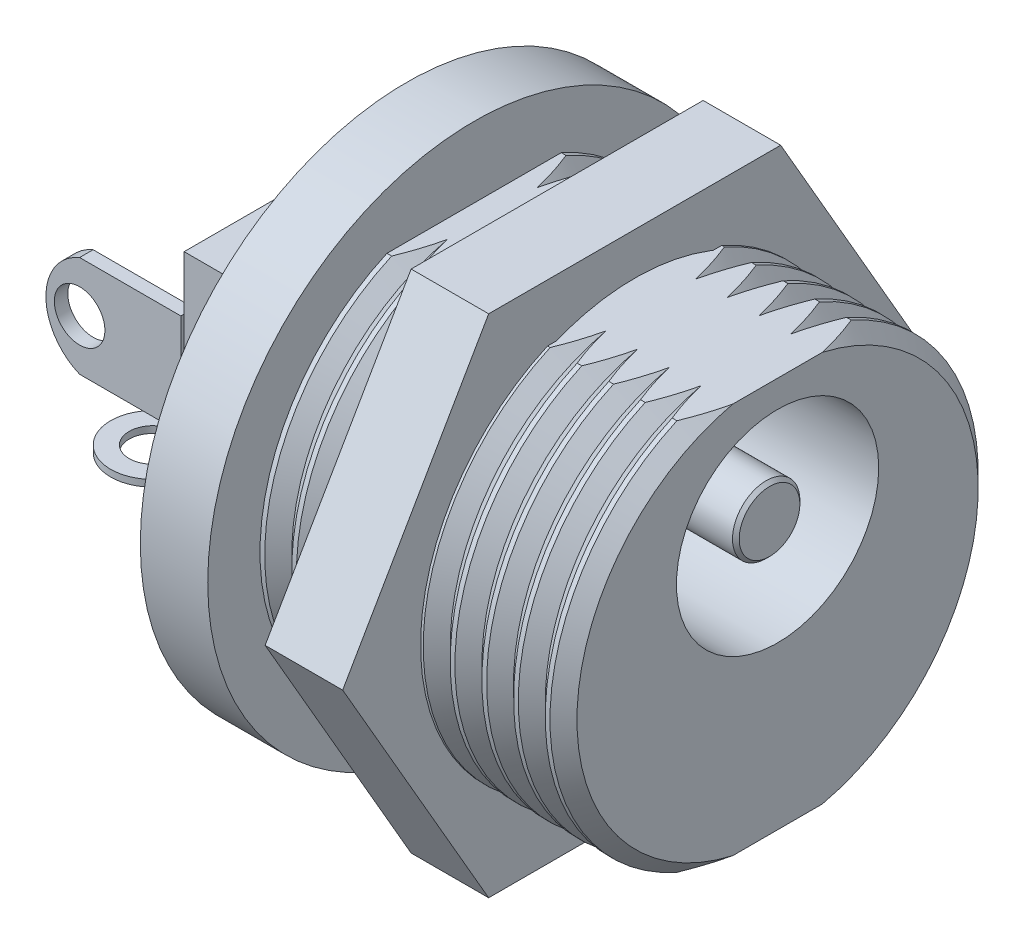
from build123d import *

# Parameters (mm, degrees)
SKETCH82_R           = 6.35
EXTRUDE34_DEPTH      = 9
SKETCH83_R           = 7.9
EXTRUDE35_DEPTH      = 2
SKETCH84_W           = 9.2
SKETCH84_H           = 9.7
EXTRUDE36_DEPTH      = 2
SKETCH85_W           = 2.5
SKETCH85_H           = 0.2
SKETCH85_H_2         = 0.3
SKETCH85_W_2         = 0.4
SKETCH85_H_3         = 3
EXTRUDE37_DEPTH      = 4.9
SKETCH86_R           = 0.75
CUT_EXTRUDE41_DEPTH  = 4.9
FILLET25_R           = 1.25
SKETCH87_R           = 3
CUT_EXTRUDE42_DEPTH  = 9
SKETCH88_R           = 6.25
EXTRUDE38_DEPTH      = 2.3
SKETCH161_R          = 1
EXTRUDE70_DEPTH      = 4
CHAMFER21_SIZE       = 0.1
SKETCH193_R          = 1
EXTRUDE82_DEPTH      = 0.3
SKETCH194_R          = 0.7
CUT_EXTRUDE103_DEPTH = 0.3
SKETCH195_R          = 0.7
CUT_EXTRUDE104_DEPTH = 0.2
LPATTERN3_COUNT      = 10
LPATTERN3_PITCH      = 0.94


with BuildPart() as part:
    # Sketch82 → Extrude34 (new body)
    with BuildSketch(Plane(origin=(0, 0, 0), x_dir=(0, 0, -1), z_dir=(1, 0, 0))):
        Circle(SKETCH82_R)
    extrude(amount=-EXTRUDE34_DEPTH)

    # Sketch83 → Extrude35 (add)
    with BuildSketch(Plane.ZY.offset(9)):
        Circle(SKETCH83_R)
    extrude(amount=EXTRUDE35_DEPTH)

    # Sketch84 → Extrude36 (add)
    with BuildSketch(Plane.ZY.offset(11)):
        Rectangle(SKETCH84_W, SKETCH84_H)
    extrude(amount=EXTRUDE36_DEPTH)

    # Sketch85 → Extrude37 (add)
    with BuildSketch(Plane.ZY.offset(13)):
        with Locations((1.88, -3.4)):
            Rectangle(SKETCH85_W, SKETCH85_H)
        with Locations((-1.52, -1.25)):
            Rectangle(SKETCH85_W, SKETCH85_H_2)
        with Locations((4.5, 1.75)):
            Rectangle(SKETCH85_W_2, SKETCH85_H_3)
    extrude(amount=EXTRUDE37_DEPTH)

    # Sketch86 → Cut-Extrude41 (cut)
    with BuildSketch(Plane(origin=(0, 0, 4.3), x_dir=(-1, 0, 0), z_dir=(0, 0, -1))):
        with Locations((16, 1.75)):
            Circle(SKETCH86_R)
        with BuildLine():
            Line((16, 3.25), (17.9, 3.25))
            Line((17.9, 3.25), (17.9, 0.25))
            Line((17.9, 0.25), (16, 0.25))
            ThreePointArc((16, 0.25), (17, 1.75), (16, 3.25))
        make_face()
    extrude(amount=-CUT_EXTRUDE41_DEPTH, mode=Mode.SUBTRACT)

    # Fillet25
    fillet25_edges = [part.edges().sort_by_distance(p)[0] for p in [
        (-17.9, -3.4, 3.13),
        (-17.9, -3.4, 0.63),
        (-17.9, -1.25, -0.27),
        (-17.9, -1.25, -2.77),
    ]]
    fillet(fillet25_edges, radius=FILLET25_R - 0.0001)  # a hair under: the kernel refuses the full size

    # Sketch87 → Cut-Extrude42 (cut)
    with BuildSketch(Plane(origin=(0, 0, 0), x_dir=(0, 0, -1), z_dir=(1, 0, 0))):
        with Locations((0, 2)):
            Circle(SKETCH87_R)
        with BuildLine():
            Line((-2.585053191, 5.8), (2.585053191, 5.8))
            ThreePointArc((2.585053191, 5.8), (0, 6.35), (-2.585053191, 5.8))
        make_face()
        with BuildLine():
            Line((-2.585053191, -5.8), (2.585053191, -5.8))
            ThreePointArc((2.585053191, -5.8), (0, -6.35), (-2.585053191, -5.8))
        make_face()
    extrude(amount=-CUT_EXTRUDE42_DEPTH, mode=Mode.SUBTRACT)

    # Sketch193 → Extrude82 (add)
    with BuildSketch(Plane.ZY.offset(13)):
        with BuildLine():
            Line((4.3, 3.25), (0, 3.25))
            ThreePointArc((0, 3.25), (-1.5, 1.75), (0, 0.25))
            Line((0, 0.25), (4.3, 0.25))
            Line((4.3, 0.25), (4.3, 3.25))
        make_face()
        with Locations((0, 1.75)):
            Circle(SKETCH193_R, mode=Mode.SUBTRACT)
    extrude(amount=EXTRUDE82_DEPTH)

    # Sketch194 → Cut-Extrude103 (cut)
    with BuildSketch(Plane.XZ.offset(1.4)):
        with Locations(Location((-16.65, -1.52, 0), (0, 0, 270))):
            Circle(SKETCH194_R)
        with BuildLine():
            Line((-13.5, -0.27), (-13.5, -0.67))
            Line((-13.5, -0.67), (-15.733484861, -0.67))
            ThreePointArc((-15.733484861, -0.67), (-16.15, -0.374356076), (-16.65, -0.27))
            Line((-16.65, -0.27), (-13.5, -0.27))
        make_face()
        with BuildLine():
            Line((-13.5, -2.77), (-16.65, -2.77))
            ThreePointArc((-16.65, -2.77), (-16.15, -2.665643924), (-15.733484861, -2.37))
            Line((-15.733484861, -2.37), (-13.5, -2.37))
            Line((-13.5, -2.37), (-13.5, -2.77))
        make_face()
    extrude(amount=-CUT_EXTRUDE103_DEPTH, mode=Mode.SUBTRACT)

    # Sketch195 → Cut-Extrude104 (cut)
    with BuildSketch(Plane.XZ.offset(3.5)):
        with Locations(Location((-16.65, 1.88, 0), (0, 0, 270))):
            Circle(SKETCH195_R)
        with BuildLine():
            Line((-13.5, 0.63), (-16.65, 0.63))
            ThreePointArc((-16.65, 0.63), (-16.15, 0.734356076), (-15.733484861, 1.03))
            Line((-15.733484861, 1.03), (-13.5, 1.03))
            Line((-13.5, 1.03), (-13.5, 0.63))
        make_face()
        with BuildLine():
            Line((-13.5, 3.13), (-16.65, 3.13))
            ThreePointArc((-16.65, 3.13), (-16.15, 3.025643924), (-15.733484861, 2.73))
            Line((-15.733484861, 2.73), (-13.5, 2.73))
            Line((-13.5, 2.73), (-13.5, 3.13))
        make_face()
    extrude(amount=-CUT_EXTRUDE104_DEPTH, mode=Mode.SUBTRACT)

    # Sketch198 → Cut-Revolve14 (revolve, cut)
    with BuildSketch(Plane(origin=(0, 0, 0), x_dir=(1, 0, 0), z_dir=(0, 1, 0))):
        Polygon((-0.4, 6.35), (0, 5.95), (0.4, 6.35), align=None)
    cut_revolve14 = revolve(axis=Axis((0, 0, 0), (-1, 0, 0)), mode=Mode.SUBTRACT)

    # LPattern3: Cut-Revolve14 ×10
    with Locations(*[(-i * LPATTERN3_PITCH, 0, 0) for i in range(1, LPATTERN3_COUNT)]):
        add(cut_revolve14, mode=Mode.SUBTRACT)


with BuildPart() as body_2:
    # Sketch88 → Extrude38 (new body)
    with BuildSketch(Plane(origin=(-4.238, 0, 0), x_dir=(0, 0, -1), z_dir=(1, 0, 0))):
        Polygon((-8.660254038, 0), (-4.330127019, -7.5), (4.330127019, -7.5), (8.660254038, 0), (4.330127019, 7.5), (-4.330127019, 7.5), align=None)
        Circle(SKETCH88_R, mode=Mode.SUBTRACT)
    extrude(amount=-EXTRUDE38_DEPTH)


with BuildPart() as body_3:
    # Sketch161 → Extrude70 (new body)
    with BuildSketch(Plane(origin=(-4.238, 0, 0), x_dir=(0, 0, -1), z_dir=(1, 0, 0))):
        with Locations((0, 2)):
            Circle(SKETCH161_R)
    extrude(amount=EXTRUDE70_DEPTH)

    # Chamfer21
    chamfer21_edges = [body_3.edges().sort_by_distance(p)[0] for p in [
        (-0.238, 2, 1),
    ]]
    chamfer(chamfer21_edges, length=CHAMFER21_SIZE)


solid = Compound([part.part, body_2.part, body_3.part])
